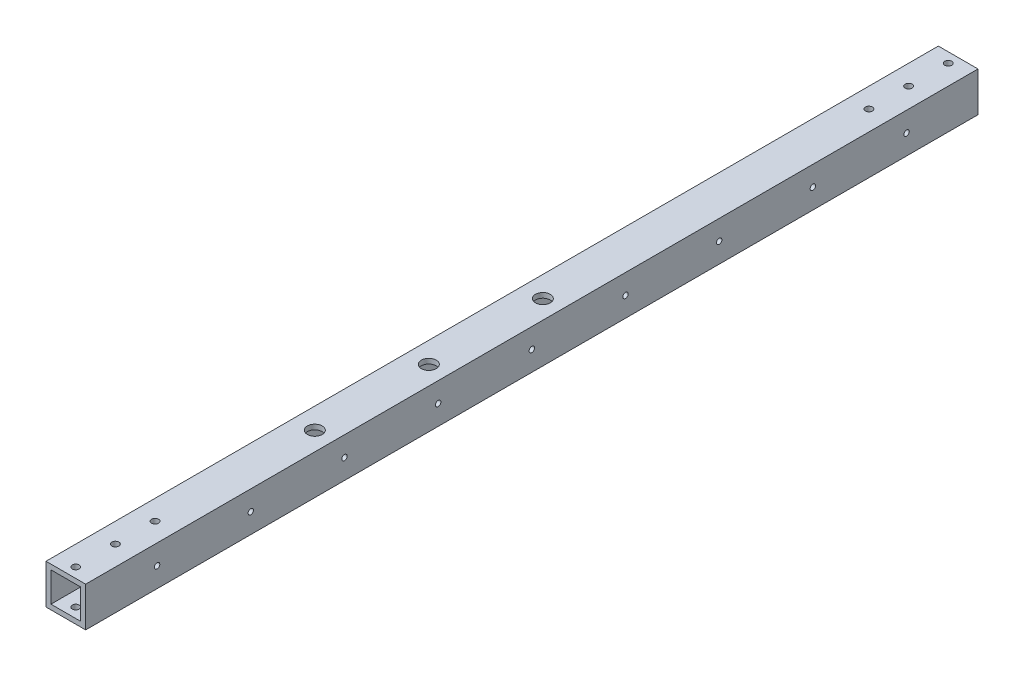
from build123d import *

# Parameters (mm, degrees)
SKETCH1_W                    = 25.4
SKETCH1_H                    = 25.4
SKETCH1_W_2                  = 19.05
SKETCH1_H_2                  = 19.05
EXTRUDE_THIN1_DEPTH          = 571.5
F_8_CLEARANCE_HOLE1_D        = 4.4958
F_8_32_TAPPED_HOLE1_D        = 3.4544
F_8_32_TAPPED_HOLE1_DEPTH    = 10.70864
F_8_32_TAPPED_HOLE1_TIP      = 1.037806461
F_3_8_0_375_DIAMETER_HOLE2_D = 9.525


with BuildPart() as part:
    # Sketch1 → Extrude-Thin1 (new body)
    with BuildSketch(Plane.XY):
        Rectangle(SKETCH1_W, SKETCH1_H)
        Rectangle(SKETCH1_W_2, SKETCH1_H_2, mode=Mode.SUBTRACT)
    extrude(amount=EXTRUDE_THIN1_DEPTH)

    # #8 Clearance Hole1 (through all)
    with Locations(Plane(origin=(0, 12.7, 565.15), x_dir=(0, 0, 1), z_dir=(0, 1, 0))):
        with Locations((0, 0), (-558.8, 0), (-533.4, 0), (-508, 0), (-25.4, 0), (-50.8, 0)):
            Hole(F_8_CLEARANCE_HOLE1_D / 2)

    # #8-32 Tapped Hole1
    with Locations(Plane(origin=(12.7, 82.55, 285.75), x_dir=(0, 0, 1), z_dir=(1, 0, 0))):
        with Locations((-300, 82.55), (-240, 82.55), (-180, 82.55), (-60, 82.55), (0, 82.55), (60, 82.55), (120, 82.55), (180, 82.55), (240, 82.55), (-120, 82.55), (-360, 82.55), (300, 82.55), (360, 82.55)):
            Hole(F_8_32_TAPPED_HOLE1_D / 2, depth=F_8_32_TAPPED_HOLE1_DEPTH)
            with Locations((0, 0, -(F_8_32_TAPPED_HOLE1_DEPTH + F_8_32_TAPPED_HOLE1_TIP / 2))):  # 118° drill point
                Cone(0, F_8_32_TAPPED_HOLE1_D / 2, F_8_32_TAPPED_HOLE1_TIP, mode=Mode.SUBTRACT)

    # 3/8 (0.375) Diameter Hole2 (through all)
    with Locations(Plane(origin=(-346.075, -12.7, 285.75), x_dir=(0, 0, 1), z_dir=(0, -1, 0))):
        with Locations((-92.7735, 346.075), (-35.6235, 346.075), (35.6235, 346.075), (92.7735, 346.075), (-19.05, -346.775), (53.975, -346.775), (127, -346.775), (-381, -114.3), (-381, -130.175), (-381, -146.05), (-381, 114.3), (-381, 98.425), (-381, 82.55)):
            Hole(F_3_8_0_375_DIAMETER_HOLE2_D / 2)


solid = part.part
